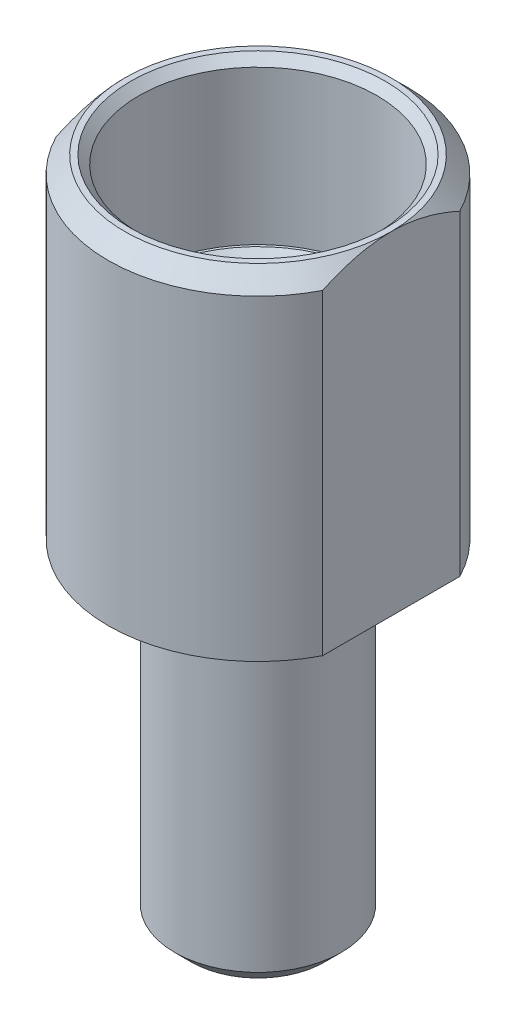
from build123d import *

# Parameters (mm, degrees)
CHANFREIN3_SIZE         = 1
ENL_V_MAT_EXTRU_1_DEPTH = 42.976183724
CHANFREIN4_SIZE         = 0.5
CHANFREIN5_SIZE         = 1.5
CHANFREIN6_SIZE         = 1
CHANFREIN7_SIZE         = 0.7
CHANFREIN2_SIZE         = 0.5


with BuildPart() as part:
    # Esquisse1 → Révolution1 (revolve)
    with BuildSketch(Plane.XY, mode=Mode.PRIVATE) as r_volution1_sk:
        Polygon((3.1, 10), (3.1, 0), (5, 0), (5, 18.12), (5, 20), (5.5, 20), (5.5, 21.22), (7.6, 21.22), (7.6, 20), (9, 20), (9, 40), (7.15, 40), (7.15, 30.27), (6.5, 30.27), (6.5, 22.77), (2.77, 22.77), (2.77, 10), align=None)
    revolve(r_volution1_sk.sketch.rotate(Axis((0, 0, 0), (0, 1, 0)), 90), axis=Axis((0, 0, 0), (0, 1, 0)))

    # Chanfrein3
    chanfrein3_edges = [part.edges().sort_by_distance(p)[0] for p in [
        (0, 40, 9),
    ]]
    chamfer(chanfrein3_edges, length=CHANFREIN3_SIZE)

    # Esquisse2 → Enlèv. mat.-Extru.1 (cut, through all)
    with BuildSketch(Plane(origin=(0, 40, 0), x_dir=(1, 0, 0), z_dir=(0, 1, 0))):
        with BuildLine():
            Line((-8, 4.123105626), (-8, -4.123105626))
            ThreePointArc((-8, -4.123105626), (-9, 0), (-8, 4.123105626))
        make_face()
        with BuildLine():
            Line((8, 4.123105626), (8, -4.123105626))
            ThreePointArc((8, -4.123105626), (9, 0), (8, 4.123105626))
        make_face()
    extrude(amount=-ENL_V_MAT_EXTRU_1_DEPTH, mode=Mode.SUBTRACT)

    # Chanfrein4
    chanfrein4_edges = [part.edges().sort_by_distance(p)[0] for p in [
        (0, 40, 7.15),
    ]]
    chamfer(chanfrein4_edges, length=CHANFREIN4_SIZE)

    # Chanfrein5
    chanfrein5_edges = [part.edges().sort_by_distance(p)[0] for p in [
        (0, 22.77, 2.77),
    ]]
    chamfer(chanfrein5_edges, length=CHANFREIN5_SIZE)

    # Chanfrein6
    chanfrein6_edges = [part.edges().sort_by_distance(p)[0] for p in [
        (0, 0, 5),
    ]]
    chamfer(chanfrein6_edges, length=CHANFREIN6_SIZE)

    # Chanfrein7
    chanfrein7_edges = [part.edges().sort_by_distance(p)[0] for p in [
        (0, 0, 3.1),
    ]]
    chamfer(chanfrein7_edges, length=CHANFREIN7_SIZE)

    # Chanfrein2
    # the kernel refuses this chamfer: 0.5 mm, written as the material it takes off along each edge
    with BuildSketch(Plane(origin=(0, 10, 0), x_dir=(0, 0, -1), z_dir=(1, 0, 0))) as chanfrein2_piece_1_section:
        Polygon((2.77 + CHANFREIN2_SIZE, 0), (2.77, CHANFREIN2_SIZE), (2.77, 0), align=None)
    chanfrein2_piece_1 = revolve(axis=Axis((0, 10, 0), (0, 1, 0)), mode=Mode.PRIVATE)
    chanfrein2_piece_1 = chanfrein2_piece_1 & Plane(origin=(0, 10.332893629, 0), x_dir=(0, 0, -1), z_dir=(0, -1, 0)) * Cylinder(3.1, 14, mode=Mode.PRIVATE)
    add(chanfrein2_piece_1, mode=Mode.SUBTRACT)
    with BuildSketch(Plane(origin=(0, 30.27, 0), x_dir=(0, 0, -1), z_dir=(1, 0, 0))) as chanfrein2_piece_2:
        Polygon((6.5, -CHANFREIN2_SIZE), (6.5 + CHANFREIN2_SIZE, 0), (6.5, 0), align=None)
    revolve(axis=Axis((0, 30.27, 0), (0, 1, 0)), mode=Mode.SUBTRACT)


solid = part.part
